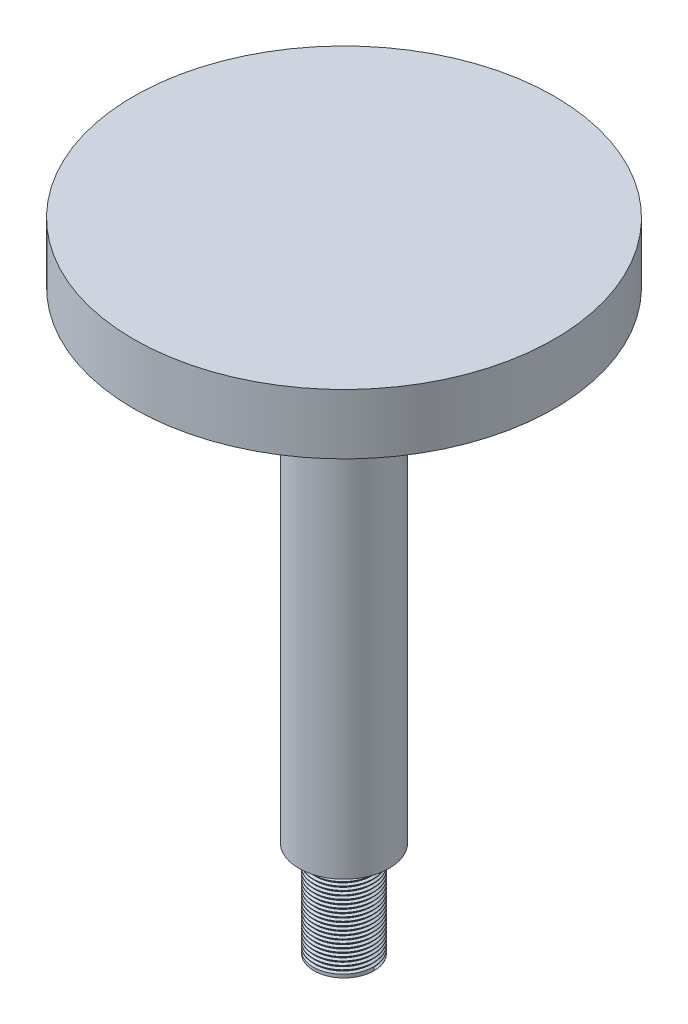
from build123d import *

# Parameters (mm, degrees)
SKETCH_1_R      = 3.75
EXTRUDE_1_DEPTH = 40
SKETCH_2_R      = 17.5
EXTRUDE_2_DEPTH = 5
SKETCH_3_R      = 2.5
EXTRUDE_3_DEPTH = 8
THREAD_1_PITCH  = 0.3175


with BuildPart() as part:
    # Sketch 1 → 보스-돌출1 (new body)
    with BuildSketch(Plane(origin=(0, 0, 0), x_dir=(1, 0, 0), z_dir=(0, 1, 0))):
        with Locations(Location((0, 0, 0), (0, 0, 270))):
            Circle(SKETCH_1_R)
    extrude(amount=EXTRUDE_1_DEPTH)

    # 스케치2 → 보스-돌출2 (add)
    with BuildSketch(Plane(origin=(0, 40, 0), x_dir=(1, 0, 0), z_dir=(0, 1, 0))):
        with Locations(Location((0, 0, 0), (0, 0, 270))):
            Circle(SKETCH_2_R)
    extrude(amount=EXTRUDE_2_DEPTH)

    # 스케치3 → 보스-돌출3 (add)
    with BuildSketch(Plane.XZ):
        with Locations(Location((0, 0, 0), (0, 0, 270))):
            Circle(SKETCH_3_R)
    extrude(amount=EXTRUDE_3_DEPTH)

    # 나사산1: the profile of Sketch 1 2 profile screwed along a right-hand helix of 25.19685 turns, 6 arcs to a turn; built about Z, then put on its axis
    thread_1_z = Axis((0, 0, 0), (0, 0, 1))
    thread_1_corners = [(2.5003, 0, -0.000173205), (2.5003, 0, 0.277985704), (2.328148085, 0, 0.17859375), (2.328148085, 0, 0.09921875)]
    with BuildLine(mode=Mode.PRIVATE) as thread_1_profile:
        Line(thread_1_corners[0], thread_1_corners[1])
        Line(thread_1_corners[1], thread_1_corners[2])
        Line(thread_1_corners[2], thread_1_corners[3])
        Line(thread_1_corners[3], thread_1_corners[0])
    thread_1_cap = Face(thread_1_profile.wire())
    thread_1_turn_angles = [0, 30, 60, 90, 120, 150, 180, 210, 240, 270, 300, 330, 360]
    thread_1_turn_weights = [1, 0.8660254037844387, 1, 0.8660254037844387, 1, 0.8660254037844387, 1, 0.8660254037844387, 1, 0.8660254037844387, 1, 0.8660254037844387, 1]
    thread_1_turn_rails = [Edge.make_bspline([Vector(p[0], p[1], 0).rotate(thread_1_z, thread_1_turn_angles[k]) / thread_1_turn_weights[k] + Vector(0, 0, p[2] + THREAD_1_PITCH * thread_1_turn_angles[k] / 360) for k in range(13)], [0, 0, 0, 1, 1, 2, 2, 3, 3, 4, 4, 5, 5, 6, 6, 6], 2, thread_1_turn_weights) for p in thread_1_corners]
    thread_1_turn_sides = [Face.make_surface_from_curves(thread_1_turn_rails[p[0]], thread_1_turn_rails[p[1]]) for p in [(0, 1), (1, 2), (2, 3), (3, 0)]]
    thread_1_last_angles = [9000, 9030, 9060, 9065.433070866, 9070.866141732]
    thread_1_last_weights = [1, 0.8660254037844387, 1, 0.9955074798730315, 1]
    thread_1_last_rails = [Edge.make_bspline([Vector(p[0], p[1], 0).rotate(thread_1_z, thread_1_last_angles[k]) / thread_1_last_weights[k] + Vector(0, 0, p[2] + THREAD_1_PITCH * thread_1_last_angles[k] / 360) for k in range(5)], [0, 0, 0, 1, 1, 2, 2, 2], 2, thread_1_last_weights) for p in thread_1_corners]
    thread_1_last_sides = [Face.make_surface_from_curves(thread_1_last_rails[p[0]], thread_1_last_rails[p[1]]) for p in [(0, 1), (1, 2), (2, 3), (3, 0)]]
    thread_1 = Plane(origin=(0, -8, 0), x_dir=(1, 0, 0), z_dir=(0, 1, 0)) * Solid(Shell([*[p.moved(Location((0, 0, THREAD_1_PITCH * i))) for i in range(25) for p in thread_1_turn_sides], *thread_1_last_sides, thread_1_cap, thread_1_cap.rotate(thread_1_z, 9070.866141732).moved(Location((0, 0, THREAD_1_PITCH * 9070.866141732 / 360)))]))
    add(thread_1, mode=Mode.SUBTRACT)


solid = part.part
